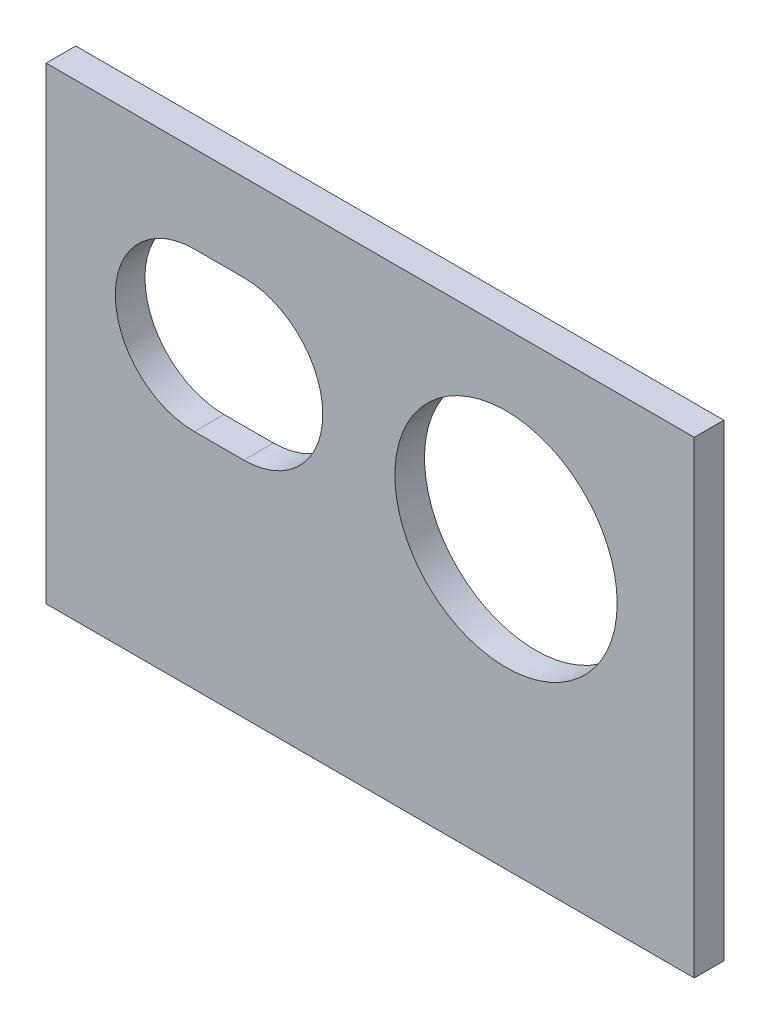
from build123d import *

# Parameters (mm, degrees)
SKETCH1_W           = 65.6
SKETCH1_H           = 47.4
BOSS_EXTRUDE1_DEPTH = 3
CUT_EXTRUDE1_REACH  = 82.988
SKETCH2_R           = 11.25


with BuildPart() as part:
    # Sketch1 → Boss-Extrude1 (new body)
    with BuildSketch(Plane.XY):
        with Locations((32.8, -23.7)):
            Rectangle(SKETCH1_W, SKETCH1_H)
    extrude(amount=BOSS_EXTRUDE1_DEPTH)

    # Sketch2 → Cut-Extrude1 (cut, up to next)
    with BuildSketch(Plane.XY.offset(3), mode=Mode.PRIVATE) as cut_extrude1_sk1:
        with Locations((46.55, -18.45)):
            Circle(SKETCH2_R)
    cut_extrude1_tool1 = extrude(cut_extrude1_sk1.sketch, amount=-CUT_EXTRUDE1_REACH, mode=Mode.PRIVATE) & part.part
    # Sketch2 → Cut-Extrude1 (cut, up to next)
    with BuildSketch(Plane.XY.offset(3), mode=Mode.PRIVATE) as cut_extrude1_sk2:
        with BuildLine():
            Line((15, -8.8), (20, -8.8))
            ThreePointArc((20, -8.8), (28, -16.8), (20, -24.8))
            Line((20, -24.8), (15, -24.8))
            ThreePointArc((15, -24.8), (7, -16.8), (15, -8.8))
        make_face()
    cut_extrude1_tool2 = extrude(cut_extrude1_sk2.sketch, amount=-CUT_EXTRUDE1_REACH, mode=Mode.PRIVATE) & part.part
    add(cut_extrude1_tool1.solids().sort_by_distance((46.55, -18.45, 3))[0], mode=Mode.SUBTRACT)
    add(cut_extrude1_tool2.solids().sort_by_distance((17.5, -16.8, 3))[0], mode=Mode.SUBTRACT)


solid = part.part
